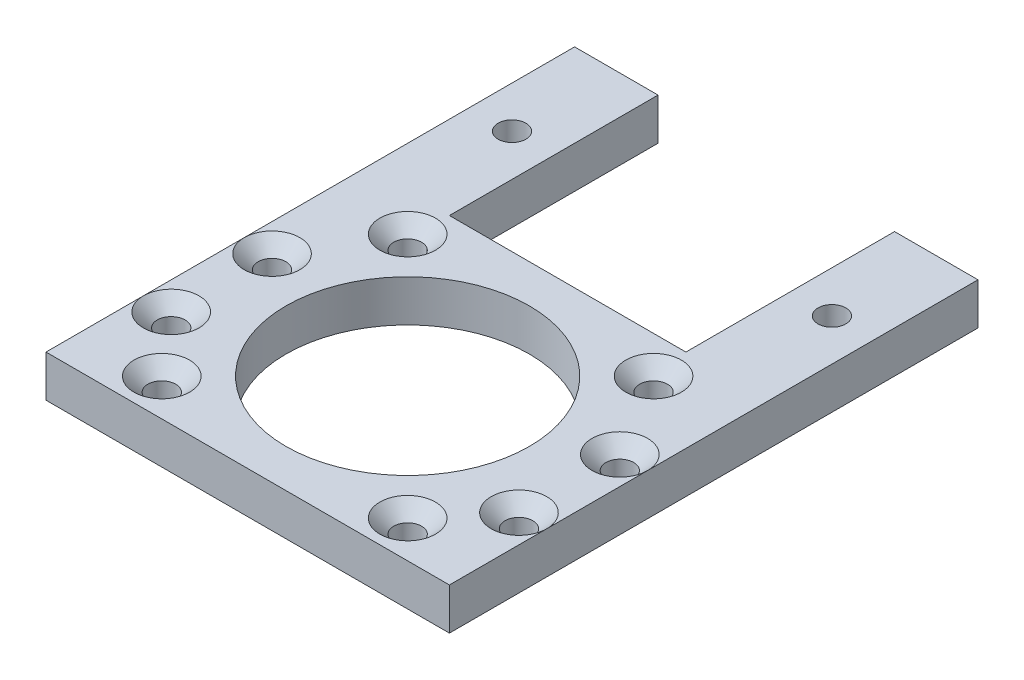
from build123d import *

# Parameters (mm, degrees)
SKETCH_1_W      = 58
SKETCH_1_H      = 46
SKETCH_1_R      = 17.5
SKETCH_1_R_2    = 2
EXTRUDE_1_DEPTH = 6
SKETCH_2_W      = 12
SKETCH_2_H      = 30
SKETCH_2_R      = 2
EXTRUDE_2_DEPTH = 6
CHAMFER_1_SIZE  = 2


with BuildPart() as part:
    # 草图1 → 凸台-拉伸1 (new body)
    with BuildSketch(Plane(origin=(0, 0, 0), x_dir=(1, 0, 0), z_dir=(0, 1, 0))):
        Rectangle(SKETCH_1_W, SKETCH_1_H)
        with Locations(Location((0, 0, 0), (0, 0, 270))):
            Circle(SKETCH_1_R, mode=Mode.SUBTRACT)
        with Locations(Location((-17.67766953, 17.67766953, 0), (0, 0, 270))):
            Circle(SKETCH_1_R_2, mode=Mode.SUBTRACT)
        with Locations(Location((-17.67766953, -17.67766953, 0), (0, 0, 270))):
            Circle(SKETCH_1_R_2, mode=Mode.SUBTRACT)
        with Locations(Location((17.67766953, 17.67766953, 0), (0, 0, 270))):
            Circle(SKETCH_1_R_2, mode=Mode.SUBTRACT)
        with Locations(Location((17.67766953, -17.67766953, 0), (0, 0, 270))):
            Circle(SKETCH_1_R_2, mode=Mode.SUBTRACT)
        with Locations(Location((-25, 5.5, 0), (0, 0, 270))):
            Circle(SKETCH_1_R_2, mode=Mode.SUBTRACT)
        with Locations(Location((-25, -9, 0), (0, 0, 270))):
            Circle(SKETCH_1_R_2, mode=Mode.SUBTRACT)
        with Locations(Location((25, -9, 0), (0, 0, 270))):
            Circle(SKETCH_1_R_2, mode=Mode.SUBTRACT)
        with Locations(Location((25, 5.5, 0), (0, 0, 270))):
            Circle(SKETCH_1_R_2, mode=Mode.SUBTRACT)
    extrude(amount=EXTRUDE_1_DEPTH)

    # 草图2 → 凸台-拉伸2 (add)
    # profile 1 of 2: a face of its own
    with BuildSketch(Plane(origin=(0, 0, 0), x_dir=(1, 0, 0), z_dir=(0, 1, 0))):
        with Locations((-23, 38)):
            Rectangle(SKETCH_2_W, SKETCH_2_H)
        with Locations(Location((-23, 38, 0), (0, 0, 270))):
            Circle(SKETCH_2_R, mode=Mode.SUBTRACT)
    # profile 2 of 2: a face of its own
    with BuildSketch(Plane(origin=(0, 0, 0), x_dir=(1, 0, 0), z_dir=(0, 1, 0))):
        with Locations((23, 38)):
            Rectangle(SKETCH_2_W, SKETCH_2_H)
        with Locations(Location((23, 38, 0), (0, 0, 90))):
            Circle(SKETCH_2_R, mode=Mode.SUBTRACT)
    extrude(amount=EXTRUDE_2_DEPTH)

    # 倒角1
    chamfer_1_edges = [part.edges().sort_by_distance(p)[0] for p in [
        (25, 6, 7),
        (-25, 6, 7),
        (-25, 6, -7.5),
        (17.67766953, 6, -19.67766953),
        (-17.67766953, 6, 15.67766953),
        (-17.67766953, 6, -19.67766953),
        (17.67766953, 6, 15.67766953),
        (25, 6, -7.5),
    ]]
    chamfer(chamfer_1_edges, length=CHAMFER_1_SIZE - 0.0001)  # a hair under: the kernel refuses the full size


solid = part.part
